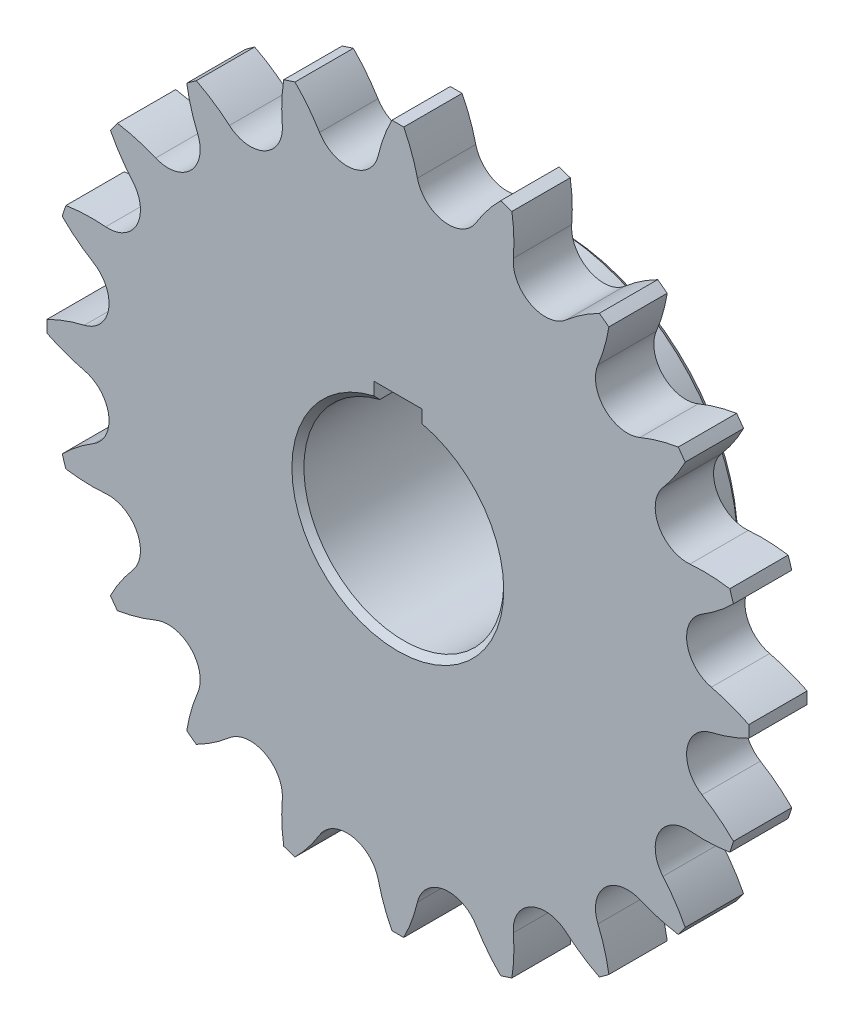
from build123d import *
from build123d.topology import SkipClean

# Parameters (mm, degrees)
SKETCH2_R           = 25
BOSS_EXTRUDE1_DEPTH = 14.6
BOSS_EXTRUDE2_START = 40
SKETCH3_R           = 46.5
SKETCH3_R_2         = 25
BOSS_EXTRUDE2_DEPTH = 40
SKETCH6_W           = 12
SKETCH6_H           = 17.793467461
CUT_EXTRUDE1_DEPTH  = 64
CHAMFER1_SIZE       = 1.5
CHAMFER2_SIZE       = 8


with BuildPart() as part:
    # Sketch2 → Boss-Extrude1 (new body)
    with BuildSketch(Plane.XY):
        with BuildLine():
            ThreePointArc((-52.801936247, 70.154195014), (-51.720450563, 65.277064388), (-50.066512977, 60.563201335))
            ThreePointArc((-50.066512977, 60.563201335), (-51.791439328, 51.791439328), (-60.563201335, 50.066512977))
            ThreePointArc((-60.563201335, 50.066512977), (-65.277064388, 51.720450563), (-70.154195014, 52.801936247))
            ThreePointArc((-70.154195014, 52.801936247), (-71.035449372, 51.610274965), (-71.896464027, 50.403908677))
            ThreePointArc((-71.896464027, 50.403908677), (-69.360793773, 46.09967927), (-66.331141862, 42.127623919))
            ThreePointArc((-66.331141862, 42.127623919), (-65.261020777, 33.252150946), (-73.070430637, 28.901024969))
            ThreePointArc((-73.070430637, 28.901024969), (-78.064675632, 29.017349295), (-83.03729995, 28.538787055))
            ThreePointArc((-83.03729995, 28.538787055), (-83.507179062, 27.133127254), (-83.953264975, 25.719736574))
            ThreePointArc((-83.953264975, 25.719736574), (-80.211619223, 22.40973635), (-76.102816424, 19.568301152))
            ThreePointArc((-76.102816424, 19.568301152), (-72.342398812, 11.457910348), (-78.425017076, 4.906503271))
            ThreePointArc((-78.425017076, 4.906503271), (-83.210772516, 3.473827702), (-87.792135411, 1.482062544))
            ThreePointArc((-87.792135411, 1.482062544), (-87.804644236, 0), (-87.792135411, -1.482062544))
            ThreePointArc((-87.792135411, -1.482062544), (-83.210772516, -3.473827702), (-78.425017076, -4.906503271))
            ThreePointArc((-78.425017076, -4.906503271), (-72.342398812, -11.457910348), (-76.102816424, -19.568301152))
            ThreePointArc((-76.102816424, -19.568301152), (-80.211619223, -22.40973635), (-83.953264975, -25.719736574))
            ThreePointArc((-83.953264975, -25.719736574), (-83.507179062, -27.133127254), (-83.03729995, -28.538787055))
            ThreePointArc((-83.03729995, -28.538787055), (-78.064675632, -29.017349295), (-73.070430637, -28.901024969))
            ThreePointArc((-73.070430637, -28.901024969), (-65.261020777, -33.252150946), (-66.331141862, -42.127623918))
            ThreePointArc((-66.331141862, -42.127623918), (-69.360793773, -46.09967927), (-71.896464027, -50.403908677))
            ThreePointArc((-71.896464027, -50.403908677), (-71.035449372, -51.610274965), (-70.154195014, -52.801936247))
            ThreePointArc((-70.154195014, -52.801936247), (-65.277064388, -51.720450563), (-60.563201335, -50.066512977))
            ThreePointArc((-60.563201335, -50.066512977), (-51.791439328, -51.791439328), (-50.066512977, -60.563201335))
            ThreePointArc((-50.066512977, -60.563201335), (-51.720450563, -65.277064388), (-52.801936247, -70.154195014))
            ThreePointArc((-52.801936247, -70.154195014), (-51.610274965, -71.035449372), (-50.403908677, -71.896464027))
            ThreePointArc((-50.403908677, -71.896464027), (-46.09967927, -69.360793773), (-42.127623918, -66.331141861))
            ThreePointArc((-42.127623918, -66.331141861), (-33.252150946, -65.261020777), (-28.901024969, -73.070430637))
            ThreePointArc((-28.901024969, -73.070430637), (-29.017349295, -78.064675632), (-28.538787055, -83.03729995))
            ThreePointArc((-28.538787055, -83.03729995), (-27.133127254, -83.507179062), (-25.719736574, -83.953264975))
            ThreePointArc((-25.719736574, -83.953264975), (-22.40973635, -80.211619223), (-19.568301152, -76.102816424))
            ThreePointArc((-19.568301152, -76.102816424), (-11.457910348, -72.342398812), (-4.906503271, -78.425017076))
            ThreePointArc((-4.906503271, -78.425017076), (-3.473827702, -83.210772516), (-1.482062544, -87.792135411))
            ThreePointArc((-1.482062544, -87.792135411), (0, -87.804644236), (1.482062544, -87.792135411))
            ThreePointArc((1.482062544, -87.792135411), (3.473827702, -83.210772516), (4.906503271, -78.425017076))
            ThreePointArc((4.906503271, -78.425017076), (11.457910348, -72.342398812), (19.568301152, -76.102816424))
            ThreePointArc((19.568301152, -76.102816424), (22.40973635, -80.211619223), (25.719736574, -83.953264975))
            ThreePointArc((25.719736574, -83.953264975), (27.133127254, -83.507179062), (28.538787055, -83.03729995))
            ThreePointArc((28.538787055, -83.03729995), (29.017349295, -78.064675632), (28.901024969, -73.070430637))
            ThreePointArc((28.901024969, -73.070430637), (33.252150946, -65.261020777), (42.127623918, -66.331141861))
            ThreePointArc((42.127623918, -66.331141861), (46.09967927, -69.360793773), (50.403908677, -71.896464027))
            ThreePointArc((50.403908677, -71.896464027), (51.610274965, -71.035449372), (52.801936247, -70.154195014))
            ThreePointArc((52.801936247, -70.154195014), (51.720450563, -65.277064388), (50.066512977, -60.563201335))
            ThreePointArc((50.066512977, -60.563201335), (51.791439328, -51.791439328), (60.563201335, -50.066512977))
            ThreePointArc((60.563201335, -50.066512977), (65.277064388, -51.720450563), (70.154195014, -52.801936247))
            ThreePointArc((70.154195014, -52.801936247), (71.035449372, -51.610274965), (71.896464027, -50.403908677))
            ThreePointArc((71.896464027, -50.403908677), (69.360793773, -46.09967927), (66.331141862, -42.127623919))
            ThreePointArc((66.331141862, -42.127623919), (65.261020777, -33.252150946), (73.070430637, -28.901024969))
            ThreePointArc((73.070430637, -28.901024969), (78.064675632, -29.017349295), (83.03729995, -28.538787055))
            ThreePointArc((83.03729995, -28.538787055), (83.507179062, -27.133127254), (83.953264975, -25.719736574))
            ThreePointArc((83.953264975, -25.719736574), (80.211619223, -22.40973635), (76.102816424, -19.568301152))
            ThreePointArc((76.102816424, -19.568301152), (72.342398812, -11.457910348), (78.425017076, -4.906503271))
            ThreePointArc((78.425017076, -4.906503271), (83.210772516, -3.473827702), (87.792135411, -1.482062544))
            ThreePointArc((87.792135411, -1.482062544), (87.804644236, 0), (87.792135411, 1.482062544))
            ThreePointArc((87.792135411, 1.482062544), (83.210772516, 3.473827702), (78.425017076, 4.906503271))
            ThreePointArc((78.425017076, 4.906503271), (72.342398812, 11.457910348), (76.102816424, 19.568301152))
            ThreePointArc((76.102816424, 19.568301152), (80.211619223, 22.40973635), (83.953264975, 25.719736575))
            ThreePointArc((83.953264975, 25.719736575), (83.507179062, 27.133127254), (83.03729995, 28.538787055))
            ThreePointArc((83.03729995, 28.538787055), (78.064675632, 29.017349295), (73.070430637, 28.901024969))
            ThreePointArc((73.070430637, 28.901024969), (65.261020777, 33.252150946), (66.331141862, 42.127623918))
            ThreePointArc((66.331141862, 42.127623918), (69.360793773, 46.09967927), (71.896464027, 50.403908677))
            ThreePointArc((71.896464027, 50.403908677), (71.035449372, 51.610274965), (70.154195014, 52.801936247))
            ThreePointArc((70.154195014, 52.801936247), (65.277064388, 51.720450563), (60.563201335, 50.066512977))
            ThreePointArc((60.563201335, 50.066512977), (51.791439328, 51.791439328), (50.066512977, 60.563201335))
            ThreePointArc((50.066512977, 60.563201335), (51.720450563, 65.277064388), (52.801936247, 70.154195014))
            ThreePointArc((52.801936247, 70.154195014), (51.610274965, 71.035449372), (50.403908677, 71.896464027))
            ThreePointArc((50.403908677, 71.896464027), (46.09967927, 69.360793773), (42.127623918, 66.331141861))
            ThreePointArc((42.127623918, 66.331141861), (33.252150946, 65.261020777), (28.901024969, 73.070430637))
            ThreePointArc((28.901024969, 73.070430637), (29.017349295, 78.064675632), (28.538787055, 83.03729995))
            ThreePointArc((28.538787055, 83.03729995), (27.133127254, 83.507179062), (25.719736574, 83.953264975))
            ThreePointArc((25.719736574, 83.953264975), (22.40973635, 80.211619223), (19.568301152, 76.102816424))
            ThreePointArc((19.568301152, 76.102816424), (11.457910348, 72.342398812), (4.906503271, 78.425017076))
            ThreePointArc((4.906503271, 78.425017076), (3.473827702, 83.210772516), (1.482062544, 87.792135411))
            ThreePointArc((1.482062544, 87.792135411), (0, 87.804644236), (-1.482062544, 87.792135411))
            ThreePointArc((-1.482062544, 87.792135411), (-3.473827702, 83.210772516), (-4.906503271, 78.425017076))
            ThreePointArc((-4.906503271, 78.425017076), (-11.457910348, 72.342398812), (-19.568301152, 76.102816424))
            ThreePointArc((-19.568301152, 76.102816424), (-22.40973635, 80.211619223), (-25.719736574, 83.953264975))
            ThreePointArc((-25.719736574, 83.953264975), (-27.133127254, 83.507179062), (-28.538787055, 83.03729995))
            ThreePointArc((-28.538787055, 83.03729995), (-29.017349295, 78.064675632), (-28.901024969, 73.070430637))
            ThreePointArc((-28.901024969, 73.070430637), (-33.252150946, 65.261020777), (-42.127623918, 66.331141862))
            ThreePointArc((-42.127623918, 66.331141862), (-46.09967927, 69.360793773), (-50.403908677, 71.896464027))
            ThreePointArc((-50.403908677, 71.896464027), (-51.610274965, 71.035449372), (-52.801936247, 70.154195014))
        make_face()
        Circle(SKETCH2_R, mode=Mode.SUBTRACT)
    extrude(amount=BOSS_EXTRUDE1_DEPTH)

    # Sketch3 → Boss-Extrude2 (add)
    with SkipClean():  # the faces are left unmerged after this step: merging them gives an invalid solid
        with BuildSketch(Plane(origin=(0, 0, 14.6), x_dir=(-1, 0, 0), z_dir=(0, 0, -1)).offset(BOSS_EXTRUDE2_START)):
            Circle(SKETCH3_R)
            Circle(SKETCH3_R_2, mode=Mode.SUBTRACT)
        extrude(amount=-BOSS_EXTRUDE2_DEPTH)

    # Sketch6 → Cut-Extrude1 (cut)
    with SkipClean():  # the faces are left unmerged after this step: merging them gives an invalid solid
        with BuildSketch(Plane(origin=(0, 0, -25.4), x_dir=(-1, 0, 0), z_dir=(0, 0, -1))):
            with Locations((0, 20.10326627)):
                Rectangle(SKETCH6_W, SKETCH6_H)
        extrude(amount=-CUT_EXTRUDE1_DEPTH, mode=Mode.SUBTRACT)
    add(part.part.scale(1), mode=Mode.REPLACE)  # the faces are merged on a copy

    # Chamfer1
    chamfer1_edges = [part.edges().sort_by_distance(p)[0] for p in [
        (15.411035007, -19.685019685, -25.4),
        (46.5, 0, -25.4),
        (-6, 26.6346611, -25.4),
        (0, 29, -25.4),
        (6, 26.6346611, -25.4),
        (-15.411035007, -19.685019685, 14.6),
    ]]
    chamfer(chamfer1_edges, length=CHAMFER1_SIZE)

    # Chamfer2
    chamfer2_edges = [part.edges().sort_by_distance(p)[0] for p in [
        (46.5, 0, 0),
    ]]
    chamfer(chamfer2_edges, length=CHAMFER2_SIZE)


solid = part.part
